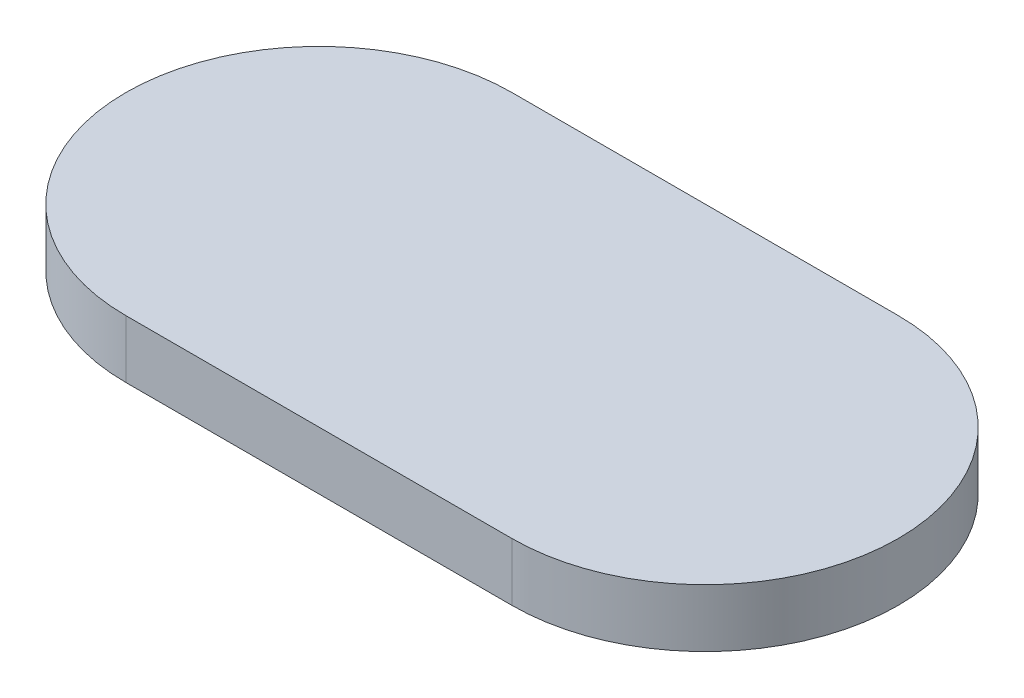
from build123d import *

# Parameters (mm, degrees)
BOSS_EXTRUDE1_DEPTH = 4.5


with BuildPart() as part:
    # Sketch2 → Boss-Extrude1 (new body)
    with BuildSketch(Plane(origin=(0, 0, 0), x_dir=(1, 0, 0), z_dir=(0, 1, 0))):
        with BuildLine():
            Line((15, 15), (-15, 15))
            ThreePointArc((-15, 15), (-30, 0), (-15, -15))
            Line((-15, -15), (15, -15))
            ThreePointArc((15, -15), (30, 0), (15, 15))
        make_face()
    extrude(amount=BOSS_EXTRUDE1_DEPTH)


solid = part.part
